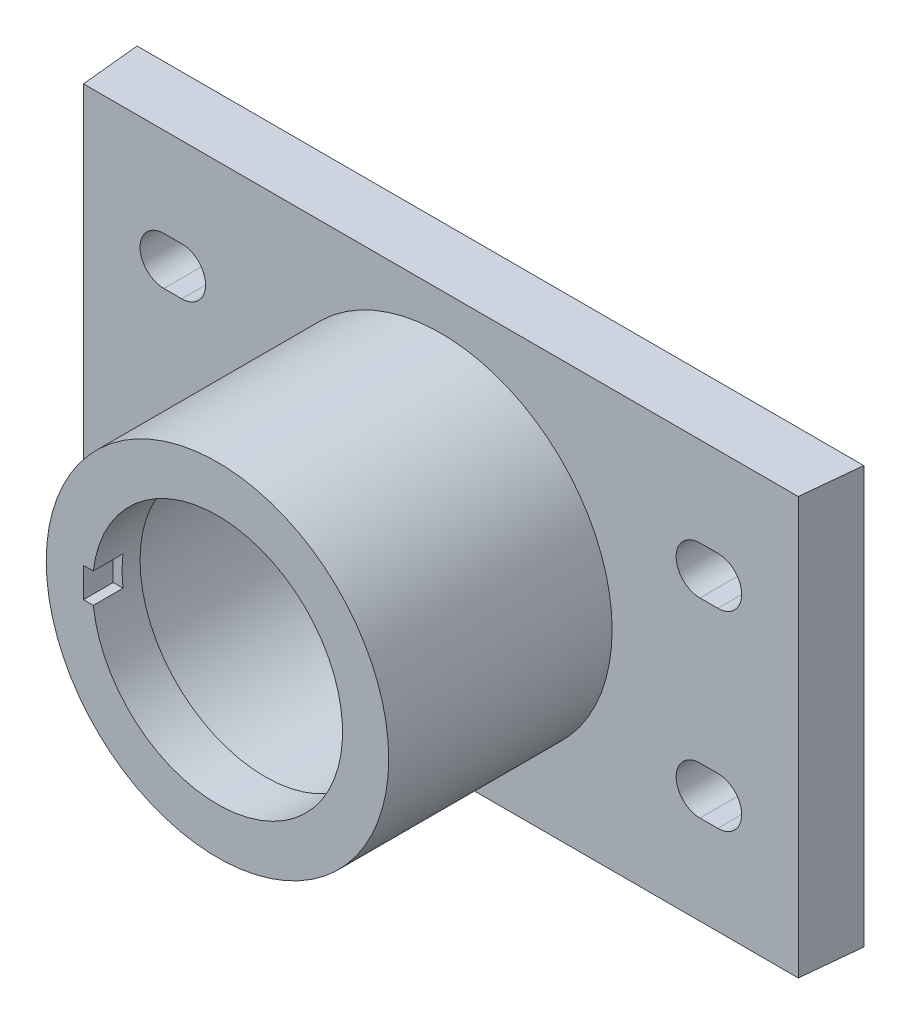
from build123d import *
from OCP.BRepAlgoAPI import BRepAlgoAPI_Cut
from OCP.TopTools import TopTools_ListOfShape

# Parameters (mm, degrees)
SKETCH1_W            = 240
SKETCH1_H            = 140
BOSS_EXTRUDE2_DEPTH  = 20
DRAFT1_ANGLE         = 5.7
SKETCH4_W            = 90.996265389
SKETCH4_H            = 101.607418567
CUT_EXTRUDE1_DEPTH   = 2
CUT_EXTRUDE3_DEPTH   = 52
MIRROR2_COPY_1_DEPTH = 52
MIRROR2_COPY_2_DEPTH = 52
SKETCH6_R            = 57.5
SKETCH6_R_2          = 42
BOSS_EXTRUDE3_DEPTH  = 75
SKETCH7_W            = 6
SKETCH7_H            = 10
CUT_EXTRUDE4_DEPTH   = 10
SKETCH8_W            = 2
SKETCH8_H            = 45


with BuildPart() as part:
    # Sketch1 → Boss-Extrude2 (new body)
    with BuildSketch(Plane.XY):
        Rectangle(SKETCH1_W, SKETCH1_H)
    extrude(amount=BOSS_EXTRUDE2_DEPTH)

    # Draft1
    draft1_faces = [part.faces().sort_by_distance(p)[0] for p in [
        (120, 0, 10),
        (-120, 0, 10),
    ]]
    draft(draft1_faces, Plane.XY.offset(20), DRAFT1_ANGLE)

    # Sketch4 → Cut-Extrude1 (cut)
    with BuildSketch(Plane(origin=(0, 0, 0), x_dir=(-1, 0, 0), z_dir=(0, 0, -1))):
        with Locations((-57.498132695, -0.196290716)):
            Rectangle(SKETCH4_W, SKETCH4_H)
        with Locations((57.498132695, -0.196290716)):
            Rectangle(SKETCH4_W, SKETCH4_H)
    extrude(amount=-CUT_EXTRUDE1_DEPTH, mode=Mode.SUBTRACT)

    # Sketch5 → Cut-Extrude3 (cut)
    with BuildSketch(Plane(origin=(0, 0, 0), x_dir=(-1, 0, 0), z_dir=(0, 0, -1))):
        with BuildLine():
            Line((-92.996265389, 24), (-86.996265389, 24))
            ThreePointArc((-86.996265389, 24), (-78.996265389, 32), (-86.996265389, 40))
            Line((-86.996265389, 40), (-92.996265389, 40))
            ThreePointArc((-92.996265389, 40), (-100.996265389, 32), (-92.996265389, 24))
        make_face()
    cut_extrude3 = extrude(amount=-CUT_EXTRUDE3_DEPTH, mode=Mode.SUBTRACT)

    # Mirror1: Cut-Extrude3 across plane
    add(cut_extrude3.mirror(Plane(origin=(0, 0, 0), x_dir=(0, 0, 1), z_dir=(1, 0, 0))), mode=Mode.SUBTRACT)

    # Mirror2 copy 1 sketch → Mirror2 copy 1 (cut)
    with BuildSketch(Plane(origin=(0, 0, 0), x_dir=(1, 0, 0), z_dir=(0, 0, -1))):
        with BuildLine():
            Line((-92.996265389, 24), (-86.996265389, 24))
            ThreePointArc((-86.996265389, 24), (-78.996265389, 32), (-86.996265389, 40))
            Line((-86.996265389, 40), (-92.996265389, 40))
            ThreePointArc((-92.996265389, 40), (-100.996265389, 32), (-92.996265389, 24))
        make_face()
    extrude(amount=-MIRROR2_COPY_1_DEPTH, mode=Mode.SUBTRACT)

    # Mirror2 copy 2 sketch → Mirror2 copy 2 (cut)
    with BuildSketch(Plane(origin=(0, 0, 0), x_dir=(-1, 0, 0), z_dir=(0, 0, -1))):
        with BuildLine():
            Line((-92.996265389, -24), (-86.996265389, -24))
            ThreePointArc((-86.996265389, -24), (-78.996265389, -32), (-86.996265389, -40))
            Line((-86.996265389, -40), (-92.996265389, -40))
            ThreePointArc((-92.996265389, -40), (-100.996265389, -32), (-92.996265389, -24))
        make_face()
    extrude(amount=-MIRROR2_COPY_2_DEPTH, mode=Mode.SUBTRACT)

    # Sketch6 → Boss-Extrude3 (add)
    with BuildSketch(Plane.XY.offset(20)):
        Circle(SKETCH6_R)
        Circle(SKETCH6_R_2, mode=Mode.SUBTRACT)
    extrude(amount=BOSS_EXTRUDE3_DEPTH)

    # Sketch7 → Cut-Extrude4 (cut)
    with BuildSketch(Plane.XY.offset(95)):
        with Locations((-42, 0)):
            Rectangle(SKETCH7_W, SKETCH7_H)
    extrude(amount=-CUT_EXTRUDE4_DEPTH, mode=Mode.SUBTRACT)


with BuildPart() as cut_revolve1_tool:
    # Sketch8 → Cut-Revolve1 (revolve)
    with BuildSketch(Plane(origin=(0, 0, 0), x_dir=(1, 0, 0), z_dir=(0, 1, 0))):
        with Locations((-43.000000734, -56.5)):
            Rectangle(SKETCH8_W, SKETCH8_H)
    revolve(axis=Axis((0, 0, 0), (0, 0, 1)))


with BuildPart() as part_1:
    add(part.part)

    # Cut-Revolve1: cut by cut_revolve1_tool, with a tolerance
    cut_revolve1_stock = TopTools_ListOfShape()
    cut_revolve1_stock.Append(part_1.part.wrapped)
    cut_revolve1_tools = TopTools_ListOfShape()
    cut_revolve1_tools.Append(cut_revolve1_tool.part.wrapped)
    cut_revolve1_cut = BRepAlgoAPI_Cut()
    cut_revolve1_cut.SetArguments(cut_revolve1_stock)
    cut_revolve1_cut.SetTools(cut_revolve1_tools)
    cut_revolve1_cut.SetFuzzyValue(0.00001)
    cut_revolve1_cut.Build()
    add(Compound.cast(cut_revolve1_cut.Shape()).solids(), mode=Mode.REPLACE)


solid = part_1.part
